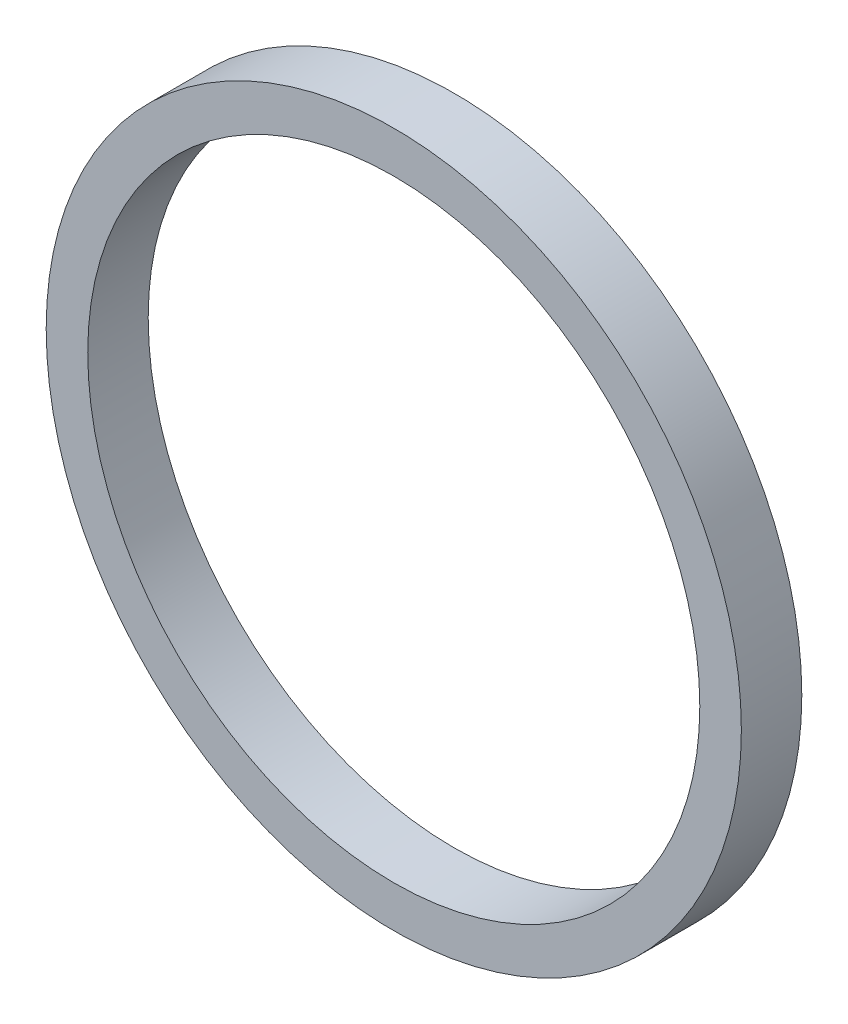
from build123d import *

# Parameters (mm, degrees)
SKETCH1_R           = 5.75
SKETCH1_R_2         = 5.0625
BOSS_EXTRUDE1_DEPTH = 1


with BuildPart() as part:
    # Sketch1 → Boss-Extrude1 (new body)
    with BuildSketch(Plane.XY):
        Circle(SKETCH1_R)
        Circle(SKETCH1_R_2, mode=Mode.SUBTRACT)
    extrude(amount=BOSS_EXTRUDE1_DEPTH)


solid = part.part
